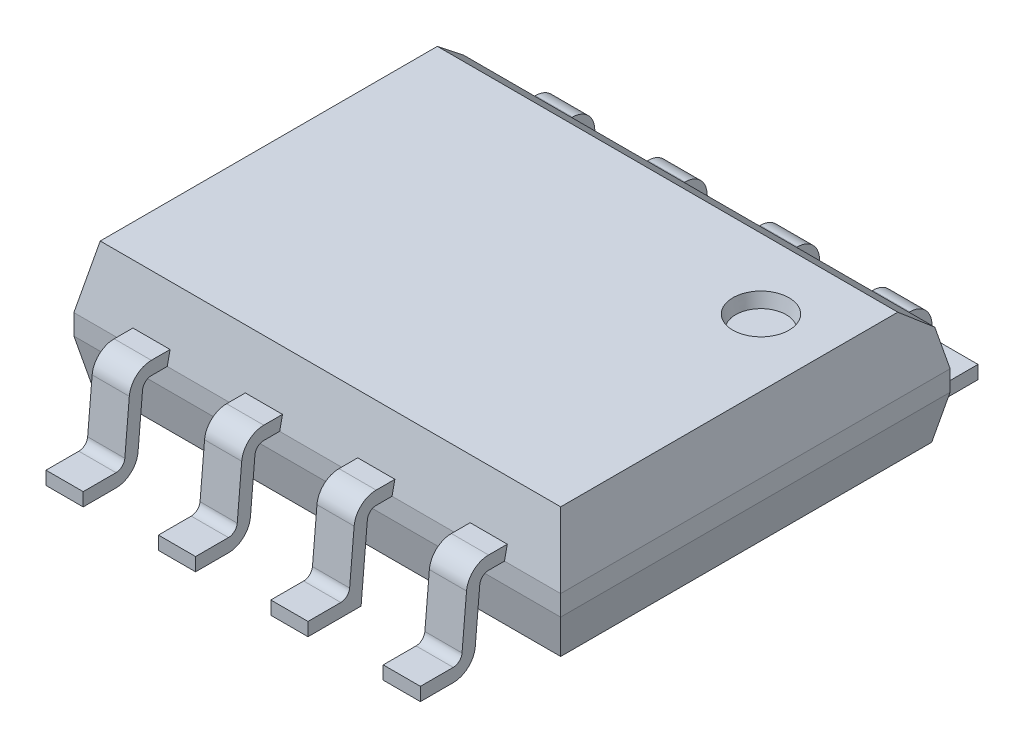
from build123d import *

# Parameters (mm, degrees)
SKETCH1_W                = 5.5
SKETCH1_H                = 4.4
EXTRUDE1_DEPTH           = 0.7
EXTRUDE1_TAPER           = 12
EXTRUDE1_OTHER_WAY_DEPTH = 0.23
SKETCH2_W                = 5.5
SKETCH2_H                = 4.4
EXTRUDE2_DEPTH           = 0.49
EXTRUDE2_TAPER           = 12
CHAMFER1_SIZE            = 0.29360287
CHAMFER1_SIZE_2          = 0.3
SKETCH3_R                = 0.317461986
CUT_EXTRUDE1_DEPTH       = 0.15
CUT_EXTRUDE1_DRAFT       = -12
EXTRUDE3_START           = 0.635
EXTRUDE3_DEPTH           = 0.21
LPATTERN3_COUNT          = 2
LPATTERN3_PITCH          = 1.27
LPATTERN3_COL_COUNT      = 3
LPATTERN3_COL_PITCH      = 1.27
FILLET1_R                = 0.1
FILLET2_R                = 0.25


with BuildPart() as part:
    # Sketch1 → Extrude1 (new body)
    with BuildSketch(Plane(origin=(0, 0, 0), x_dir=(1, 0, 0), z_dir=(0, 1, 0))):
        Rectangle(SKETCH1_W, SKETCH1_H)
    extrude(amount=EXTRUDE1_DEPTH, taper=EXTRUDE1_TAPER)

    # Sketch1 → Extrude1 other way (add)
    with BuildSketch(Plane(origin=(0, 0, 0), x_dir=(1, 0, 0), z_dir=(0, 1, 0))):
        Rectangle(SKETCH1_W, SKETCH1_H)
    extrude(amount=-EXTRUDE1_OTHER_WAY_DEPTH)

    # Sketch2 → Extrude2 (add)
    with BuildSketch(Plane.XZ.offset(0.23)):
        Rectangle(SKETCH2_W, SKETCH2_H)
    extrude(amount=EXTRUDE2_DEPTH, taper=EXTRUDE2_TAPER)

    # Chamfer1
    # the kernel refuses this chamfer: 0.3, 0.29360287 mm, written as the material it takes off along each edge
    with BuildSketch(Plane(origin=(3.374914076, 0.7, -2.051210407), x_dir=(0, 0.025194664498195945, 0.9996825640576229), z_dir=(-1, 0, 0))) as chamfer1_piece_1:
        Polygon((CHAMFER1_SIZE * 0.999682563914, -CHAMFER1_SIZE * 0.0251946644946), (-CHAMFER1_SIZE_2 * 0.232489792804, -CHAMFER1_SIZE_2 * 0.972598836233), (0, 0), align=None)
    extrude(amount=6.749828151, mode=Mode.SUBTRACT)


with BuildPart() as cut_extrude1_tool:
    # Sketch3 → Cut-Extrude1 (with draft: the straight prism first)
    with BuildSketch(Plane(origin=(0, 0.7, 0), x_dir=(-1, 0, 0), z_dir=(0, 1, 0))):
        with Locations((-1.845269249, -0.967381419)):
            Circle(SKETCH3_R)
    extrude(amount=-CUT_EXTRUDE1_DEPTH)
    # Cut-Extrude1: the draft: its side faces are tilted about the plane it starts from
    cut_extrude1_sides = [cut_extrude1_tool.faces().sort_by_distance(p)[0] for p in [
        (2.162731235, 0.625, -0.967381419),
    ]]
    draft(cut_extrude1_sides, Plane(origin=(0, 0.7, 0), x_dir=(-1, 0, 0), z_dir=(0, 1, 0)), CUT_EXTRUDE1_DRAFT)


with BuildPart() as part_1:
    add(part.part)

    # Cut-Extrude1: cut by cut_extrude1_tool
    add(cut_extrude1_tool.part, mode=Mode.SUBTRACT)

    # Sketch4 → Extrude3 (add, symmetric)
    with BuildSketch(Plane(origin=(0, 0, 0), x_dir=(0, 0, -1), z_dir=(1, 0, 0)).offset(EXTRUDE3_START)):
        Polygon((-2.687449676, -0.75), (-2.608709879, 0.15), (2.608709879, 0.15), (2.687449676, -0.75), (3.15, -0.75), (3.15, -0.9), (2.55, -0.9), (2.471260203, 0), (-2.471260203, 0), (-2.55, -0.9), (-3.15, -0.9), (-3.15, -0.75), align=None)
    extrude3 = extrude(amount=EXTRUDE3_DEPTH, both=True)

    # LPattern3: Extrude3 ×2
    with Locations(*[(i * LPATTERN3_PITCH, 0, 0) for i in range(1, LPATTERN3_COUNT)]):
        add(extrude3)

    # LPattern3 col: Extrude3 ×3
    with Locations(*[(-i * LPATTERN3_COL_PITCH, 0, 0) for i in range(1, LPATTERN3_COL_COUNT)]):
        add(extrude3)

    # Fillet1
    fillet1_edges = [part_1.edges().sort_by_distance(p)[0] for p in [
        (-0.635, -0.75, 2.687449676),
        (-0.635, 0, 2.471260203),
        (-0.635, 0, -2.471260203),
        (-1.905, -0.75, -2.687449676),
        (-1.905, -0.75, 2.687449676),
        (-1.905, 0, 2.471260203),
        (-1.905, 0, -2.471260203),
        (1.905, -0.75, -2.687449676),
        (1.905, -0.75, 2.687449676),
        (1.905, 0, 2.471260203),
        (1.905, 0, -2.471260203),
        (0.635, -0.75, -2.687449676),
        (0.635, -0.75, 2.687449676),
        (0.635, 0, 2.471260203),
        (0.635, 0, -2.471260203),
        (-0.635, -0.75, -2.687449676),
    ]]
    fillet(fillet1_edges, radius=FILLET1_R)

    # Fillet2
    fillet2_edges = [part_1.edges().sort_by_distance(p)[0] for p in [
        (-0.635, -0.9, 2.55),
        (-0.635, -0.9, -2.55),
        (-1.905, 0.15, -2.608709879),
        (-1.905, 0.15, 2.608709879),
        (-1.905, -0.9, 2.55),
        (-1.905, -0.9, -2.55),
        (1.905, 0.15, -2.608709879),
        (1.905, 0.15, 2.608709879),
        (1.905, -0.9, 2.55),
        (1.905, -0.9, -2.55),
        (0.635, 0.15, -2.608709879),
        (0.635, 0.15, 2.608709879),
        (0.635, -0.9, -2.55),
        (-0.635, 0.15, -2.608709879),
        (-0.635, 0.15, 2.608709879),
    ]]
    fillet(fillet2_edges, radius=FILLET2_R)


solid = part_1.part
